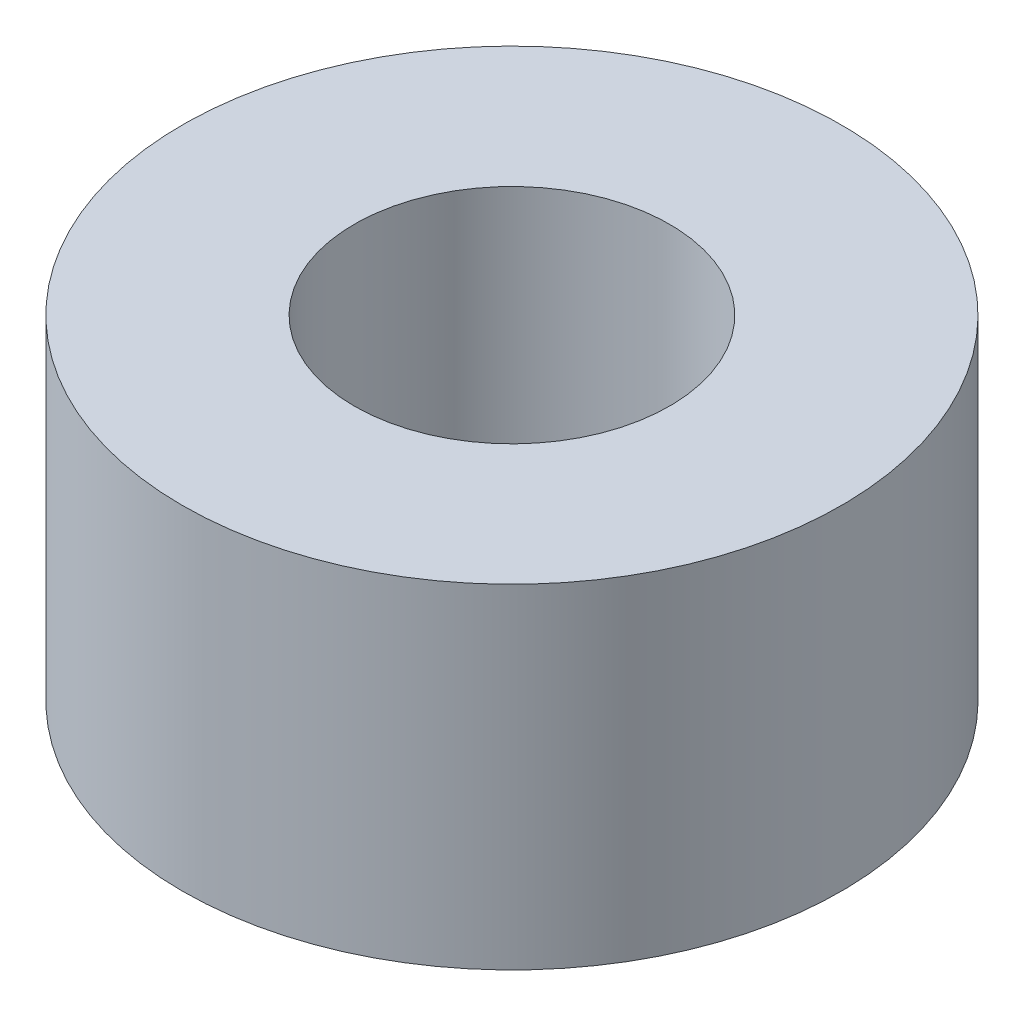
from build123d import *

# Parameters (mm, degrees)
SKETCH1_R           = 15
BOSS_EXTRUDE1_DEPTH = 15.20366035
SKETCH2_R           = 7.173842903
CUT_EXTRUDE1_DEPTH  = 27.098875226


with BuildPart() as part:
    # Sketch1 → Boss-Extrude1 (new body)
    with BuildSketch(Plane(origin=(0, 0, 0), x_dir=(1, 0, 0), z_dir=(0, 1, 0))):
        Circle(SKETCH1_R)
    extrude(amount=BOSS_EXTRUDE1_DEPTH)

    # Sketch2 → Cut-Extrude1 (cut, through all)
    with BuildSketch(Plane(origin=(0, 0, 0), x_dir=(1, 0, 0), z_dir=(0, 1, 0))):
        Circle(SKETCH2_R)
    extrude(amount=CUT_EXTRUDE1_DEPTH, mode=Mode.SUBTRACT)


solid = part.part
